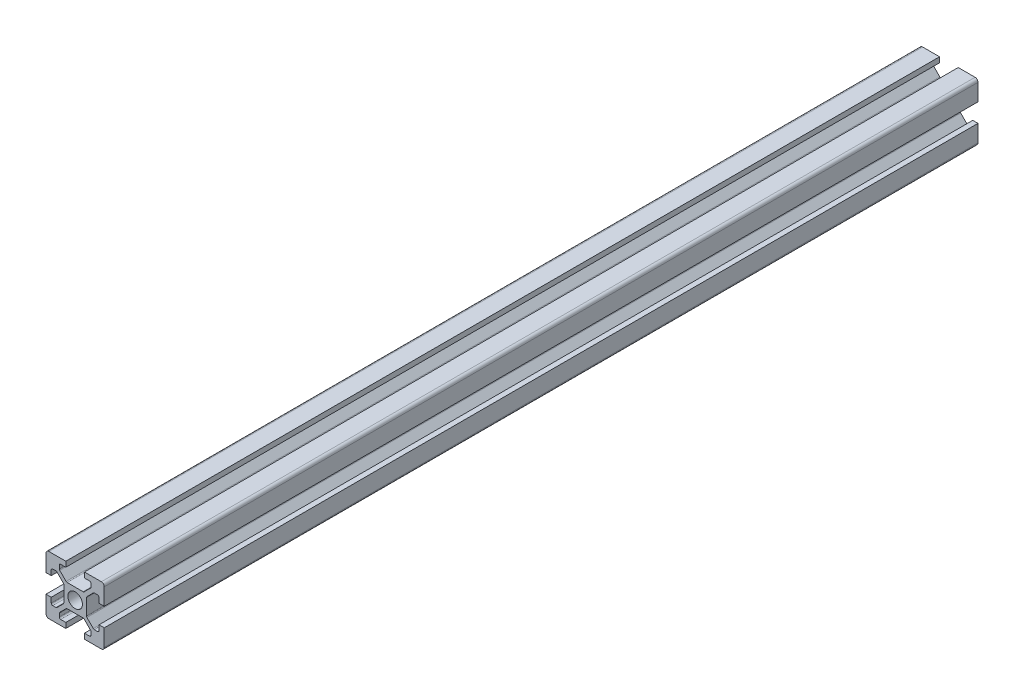
from build123d import *

# Parameters (mm, degrees)
SKETCH1_R           = 2.5
BOSS_EXTRUDE1_DEPTH = 300
FILLET1_R           = 1
FILLET2_R           = 0.5
FILLET3_R           = 0.5
FILLET4_R           = 0.5
FILLET5_R           = 0.5


with BuildPart() as part:
    # Sketch1 → Boss-Extrude1 (new body)
    with BuildSketch(Plane.XY):
        Polygon((0, 6.8), (0, 0), (6.8, 0), (6.8, 1.8), (4.55, 1.8), (4.55, 3.6), (7.05, 6.1), (12.95, 6.1), (15.45, 3.6), (15.45, 1.8), (13.2, 1.8), (13.2, 0), (20, 0), (20, 6.8), (18.2, 6.8), (18.2, 4.55), (16.4, 4.55), (13.9, 7.05), (13.9, 12.95), (16.4, 15.45), (18.2, 15.45), (18.2, 13.2), (20, 13.2), (20, 20), (13.2, 20), (13.2, 18.2), (15.45, 18.2), (15.45, 16.4), (12.95, 13.9), (7.05, 13.9), (4.55, 16.4), (4.55, 18.2), (6.8, 18.2), (6.8, 20), (0, 20), (0, 13.2), (1.8, 13.2), (1.8, 15.45), (3.6, 15.45), (6.1, 12.95), (6.1, 7.05), (3.6, 4.55), (1.8, 4.55), (1.8, 6.8), align=None)
        with Locations((10, 10)):
            Circle(SKETCH1_R, mode=Mode.SUBTRACT)
    extrude(amount=BOSS_EXTRUDE1_DEPTH)

    # Fillet1
    fillet1_edges = [part.edges().sort_by_distance(p)[0] for p in [
        (20, 20, 150),
        (20, 0, 150),
        (0, 0, 150),
        (0, 20, 150),
    ]]
    fillet(fillet1_edges, radius=FILLET1_R)

    # Fillet2
    fillet2_edges = [part.edges().sort_by_distance(p)[0] for p in [
        (4.55, 18.2, 150),
        (4.55, 16.4, 150),
        (7.05, 13.9, 150),
        (15.45, 18.2, 150),
        (15.45, 16.4, 150),
        (12.95, 13.9, 150),
    ]]
    fillet(fillet2_edges, radius=FILLET2_R)

    # Fillet3
    fillet3_edges = [part.edges().sort_by_distance(p)[0] for p in [
        (18.2, 15.45, 150),
        (16.4, 15.45, 150),
        (13.9, 12.95, 150),
        (18.2, 4.55, 150),
        (13.9, 7.05, 150),
        (16.4, 4.55, 150),
    ]]
    fillet(fillet3_edges, radius=FILLET3_R)

    # Fillet4
    fillet4_edges = [part.edges().sort_by_distance(p)[0] for p in [
        (1.8, 15.45, 150),
        (3.6, 15.45, 150),
        (6.1, 12.95, 150),
        (3.6, 4.55, 150),
        (1.8, 4.55, 150),
        (6.1, 7.05, 150),
    ]]
    fillet(fillet4_edges, radius=FILLET4_R)

    # Fillet5
    fillet5_edges = [part.edges().sort_by_distance(p)[0] for p in [
        (7.05, 6.1, 150),
        (4.55, 3.6, 150),
        (4.55, 1.8, 150),
        (15.45, 1.8, 150),
        (15.45, 3.6, 150),
        (12.95, 6.1, 150),
    ]]
    fillet(fillet5_edges, radius=FILLET5_R)


solid = part.part
